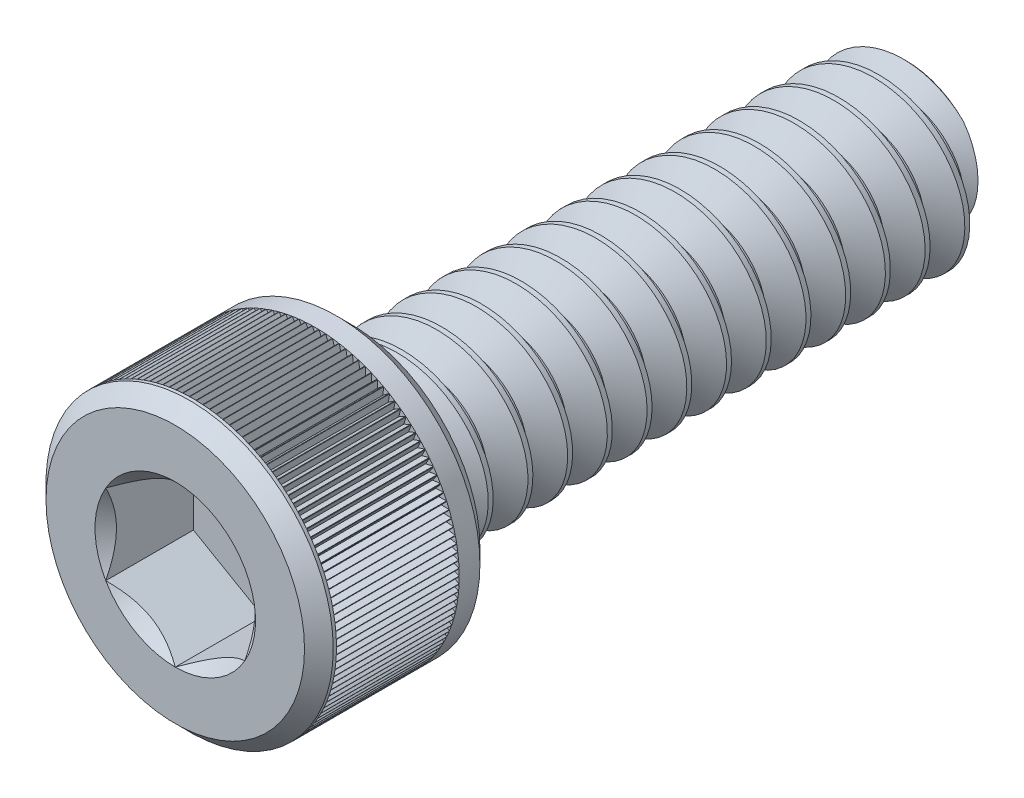
from build123d import *

# Parameters (mm, degrees)
CUT_EXTRUDE1_DEPTH = 1.7526
CUT_SWEEP1_PITCH   = 0.79375
CUT_EXTRUDE3_START = 1.40208
CUT_EXTRUDE3_DEPTH = 2.45364
CIRPATTERN1_COUNT  = 134


# Read off the part's stored shape, not the designer's step: Split1
with BuildPart() as part:
    # Sketch2 → Revolve1 (revolve)
    with BuildSketch(Plane(origin=(0, 0, 0), x_dir=(0, 0, -1), z_dir=(1, 0, 0)), mode=Mode.PRIVATE) as revolve1_sk:
        Polygon((11.1125, 1.57734), (10.93724, 1.7526), (0, 1.7526), (0, 2.58318), (-0.28702, 2.8702), (-3.21818, 2.8702), (-3.5052, 2.58318), (-3.5052, 1.3890625), (-1.7526, 1.3890625), (-1.7526, 0), (11.1125, 0), align=None)
    revolve(revolve1_sk.sketch.rotate(Axis((0, 0, 1.7526), (0, 0, -1)), 90), axis=Axis((0, 0, 1.7526), (0, 0, -1)))

    # Sketch3 → Cut-Extrude1 (cut)
    with BuildSketch(Plane.XY.offset(3.5052)):
        Polygon((0, 1.603951217), (-1.3890625, 0.801975608), (-1.3890625, -0.801975608), (0, -1.603951217), (1.3890625, -0.801975608), (1.3890625, 0.801975608), align=None)
    extrude(amount=-CUT_EXTRUDE1_DEPTH, mode=Mode.SUBTRACT)

    # Cut-Extrude2 cone 1 section (through the dimple's axis) → Cut-Extrude2 (revolve, cut)
    with BuildSketch(Plane(origin=(0, 0, 3.5052), x_dir=(0, -1, 0), z_dir=(1, 0, 0))):
        Polygon((0, 0), (1.603951217, 0), (0, 1.603951217), align=None)
    revolve(axis=Axis((0, 0, 3.5052), (0, 0, -1)), mode=Mode.SUBTRACT)


with BuildPart() as body_2:
    # Split1: the piece on the far side of the plane
    add(part.part)
    split(bisect_by=Plane.XY, keep=Keep.BOTTOM)

    # Cut-Sweep1: the profile of Sketch7 screwed along a right-hand helix of 15 turns, 8 arcs to a turn; built about Z, then put on its axis
    cut_sweep1_z = Axis((0, 0, 0), (0, 0, 1))
    cut_sweep1_corners = [(1.795562979, 0, -0.719335937), (1.838525958, 0, 0.049609375), (1.237044252, 0, -0.29765625), (1.237044252, 0, -0.396875)]
    with BuildLine(mode=Mode.PRIVATE) as cut_sweep1_profile:
        Line(cut_sweep1_corners[0], cut_sweep1_corners[1])
        Line(cut_sweep1_corners[1], cut_sweep1_corners[2])
        Line(cut_sweep1_corners[2], cut_sweep1_corners[3])
        Line(cut_sweep1_corners[3], cut_sweep1_corners[0])
    cut_sweep1_cap = Face(cut_sweep1_profile.wire())
    cut_sweep1_turn_angles = [0, 22.5, 45, 67.5, 90, 112.5, 135, 157.5, 180, 202.5, 225, 247.5, 270, 292.5, 315, 337.5, 360]
    cut_sweep1_turn_weights = [1, 0.9238795325112867, 1, 0.9238795325112867, 1, 0.9238795325112867, 1, 0.9238795325112867, 1, 0.9238795325112867, 1, 0.9238795325112867, 1, 0.9238795325112867, 1, 0.9238795325112867, 1]
    cut_sweep1_turn_rails = [Edge.make_bspline([Vector(p[0], p[1], 0).rotate(cut_sweep1_z, cut_sweep1_turn_angles[k]) / cut_sweep1_turn_weights[k] + Vector(0, 0, p[2] + CUT_SWEEP1_PITCH * cut_sweep1_turn_angles[k] / 360) for k in range(17)], [0, 0, 0, 1, 1, 2, 2, 3, 3, 4, 4, 5, 5, 6, 6, 7, 7, 8, 8, 8], 2, cut_sweep1_turn_weights) for p in cut_sweep1_corners]
    cut_sweep1_turn_sides = [Face.make_surface_from_curves(cut_sweep1_turn_rails[p[0]], cut_sweep1_turn_rails[p[1]]) for p in [(0, 1), (1, 2), (2, 3), (3, 0)]]
    cut_sweep1 = Plane(origin=(0, 0, 0), x_dir=(0, 1, 0), z_dir=(0, 0, -1)) * Solid(Shell([*[p.moved(Location((0, 0, CUT_SWEEP1_PITCH * i))) for i in range(15) for p in cut_sweep1_turn_sides], cut_sweep1_cap, cut_sweep1_cap.rotate(cut_sweep1_z, 5400).moved(Location((0, 0, CUT_SWEEP1_PITCH * 5400 / 360)))]))
    add(cut_sweep1, mode=Mode.SUBTRACT)


with BuildPart() as part_1:
    add(part.part)

    # Split1
    split(bisect_by=Plane.XY, keep=Keep.TOP)

    # Combine1: union body 2
    add(body_2.part)

    # Sketch8 → Cut-Extrude3 (cut)
    with BuildSketch(Plane.XY.offset(1.7526).offset(CUT_EXTRUDE3_START)):
        with BuildLine():
            Line((-0.062613083, 2.86951697), (0, 2.72669))
            Line((0, 2.72669), (0.062613083, 2.86951697))
            ThreePointArc((0.062613083, 2.86951697), (0, 2.8702), (-0.062613083, 2.86951697))
        make_face()
    cut_extrude3 = extrude(amount=-CUT_EXTRUDE3_DEPTH, mode=Mode.SUBTRACT)

    # CirPattern1: Cut-Extrude3 ×134 about axis
    cirpattern1_axis = Axis((0, 0, 0), (0, 0, 1))
    for i in range(1, CIRPATTERN1_COUNT):
        add(cut_extrude3.rotate(cirpattern1_axis, i * 360 / CIRPATTERN1_COUNT), mode=Mode.SUBTRACT)


solid = part_1.part
